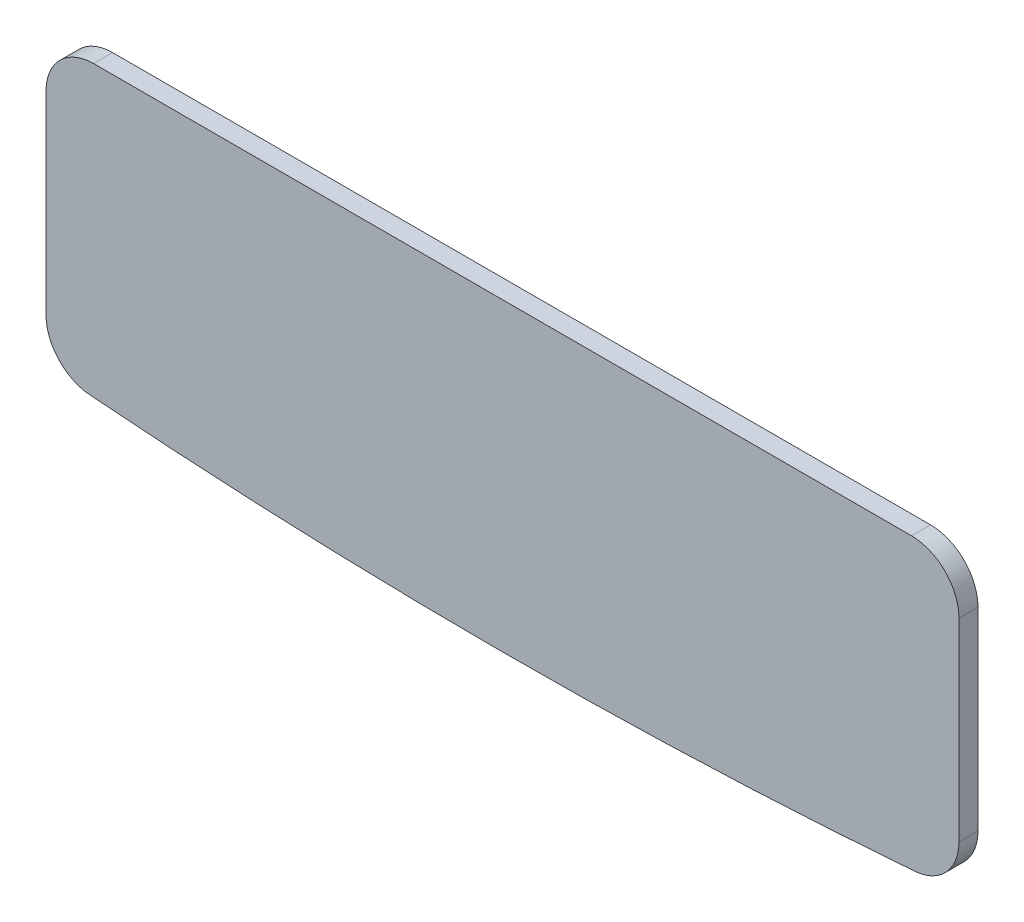
from build123d import *

# Parameters (mm, degrees)
SM_START               = -2
SM_BASE_FLANGE_1_DEPTH = 2
FILLET_1_R             = 5


# Read off the part's stored shape, not the designer's step: 基体-法兰1
with BuildPart() as part:
    # 基体-法兰1 outline → 基体-法兰1 (new body)
    with BuildSketch(Plane.XY.offset(SM_START)):
        with BuildLine():
            Line((-48.022814254, -518.903278649), (-48.022814254, -548.903278649))
            ThreePointArc((-48.022814254, -548.903278649), (0, -551), (48.022814254, -548.903278649))
            Line((48.022814254, -548.903278649), (48.022814254, -518.903278649))
            Line((48.022814254, -518.903278649), (-48.022814254, -518.903278649))
        make_face()
    extrude(amount=SM_BASE_FLANGE_1_DEPTH)

    # 圆角1
    fillet_1_edges = [part.edges().sort_by_distance(p)[0] for p in [
        (-48.022814254, -548.903278649, -1),
        (-48.022814254, -518.903278649, -1),
        (48.022814254, -518.903278649, -1),
        (48.022814254, -548.903278649, -1),
    ]]
    fillet(fillet_1_edges, radius=FILLET_1_R)


solid = part.part
